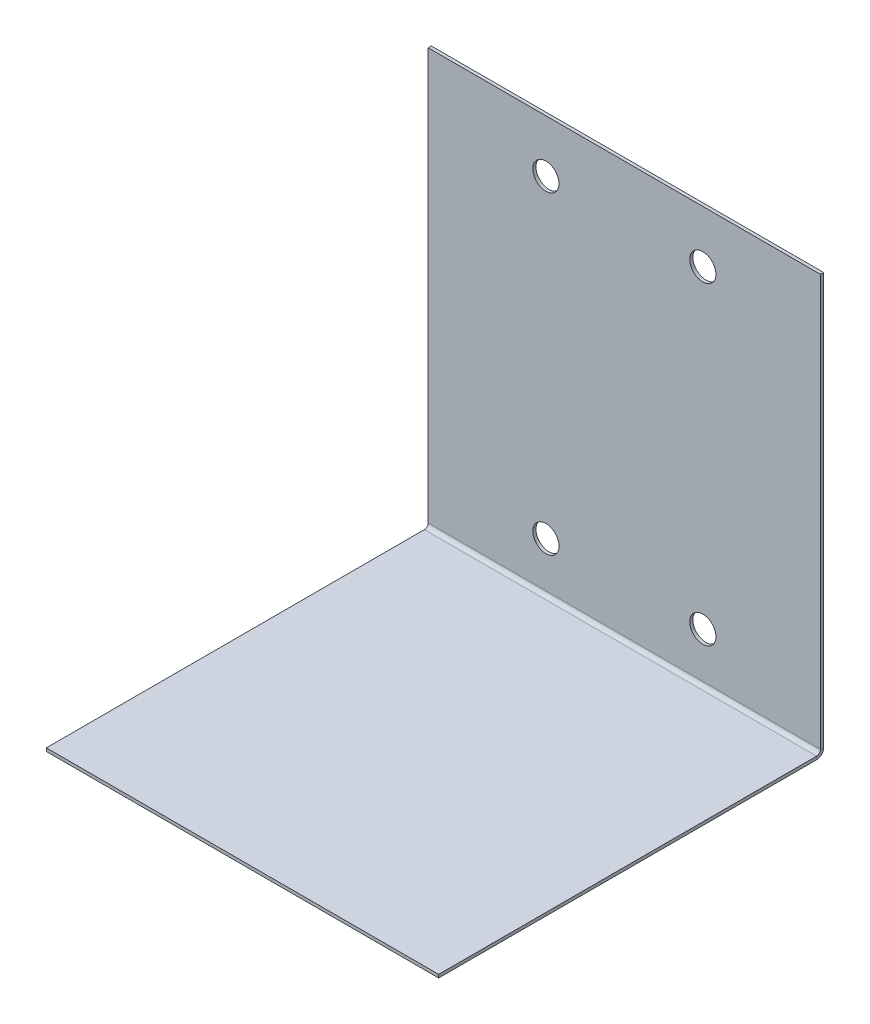
from build123d import *

# Parameters (mm, degrees)
SKETCH2_W                    = 75
SKETCH2_H                    = 80
BASE_FLANGE1_DEPTH           = 0.6
CUT_EXTRUDE1_REACH           = 111.66
SKETCH10_R                   = 2.5
EDGE_FLANGE1_STRIP_W         = 3.8732
EDGE_FLANGE1_STRIP_H         = 0.6
EDGE_FLANGE1_STRIP_CUT_DEPTH = 75
EDGE_FLANGE1_DEPTH           = 75


# Sheet-metal steps are written as plain solids
with BuildPart() as part:
    # Sketch2 → Base-Flange1 (new body)
    with BuildSketch(Plane.XY):
        with Locations((37.5, 40)):
            Rectangle(SKETCH2_W, SKETCH2_H)
    extrude(amount=-BASE_FLANGE1_DEPTH)

    # Sketch10 → Cut-Extrude1 (cut, up to next)
    with BuildSketch(Plane(origin=(0, 0, -0.6), x_dir=(-1, 0, 0), z_dir=(0, 0, -1)), mode=Mode.PRIVATE) as cut_extrude1_sk1:
        with Locations((-22.5, 10)):
            Circle(SKETCH10_R)
    cut_extrude1_tool1 = extrude(cut_extrude1_sk1.sketch, amount=-CUT_EXTRUDE1_REACH, mode=Mode.PRIVATE) & part.part
    # Sketch10 → Cut-Extrude1 (cut, up to next)
    with BuildSketch(Plane(origin=(0, 0, -0.6), x_dir=(-1, 0, 0), z_dir=(0, 0, -1)), mode=Mode.PRIVATE) as cut_extrude1_sk2:
        with Locations((-52.5, 70)):
            Circle(SKETCH10_R)
    cut_extrude1_tool2 = extrude(cut_extrude1_sk2.sketch, amount=-CUT_EXTRUDE1_REACH, mode=Mode.PRIVATE) & part.part
    # Sketch10 → Cut-Extrude1 (cut, up to next)
    with BuildSketch(Plane(origin=(0, 0, -0.6), x_dir=(-1, 0, 0), z_dir=(0, 0, -1)), mode=Mode.PRIVATE) as cut_extrude1_sk3:
        with Locations((-52.5, 10)):
            Circle(SKETCH10_R)
    cut_extrude1_tool3 = extrude(cut_extrude1_sk3.sketch, amount=-CUT_EXTRUDE1_REACH, mode=Mode.PRIVATE) & part.part
    # Sketch10 → Cut-Extrude1 (cut, up to next)
    with BuildSketch(Plane(origin=(0, 0, -0.6), x_dir=(-1, 0, 0), z_dir=(0, 0, -1)), mode=Mode.PRIVATE) as cut_extrude1_sk4:
        with Locations((-22.5, 70)):
            Circle(SKETCH10_R)
    cut_extrude1_tool4 = extrude(cut_extrude1_sk4.sketch, amount=-CUT_EXTRUDE1_REACH, mode=Mode.PRIVATE) & part.part
    add(cut_extrude1_tool1.solids().sort_by_distance((22.5, 10, -0.6))[0], mode=Mode.SUBTRACT)
    add(cut_extrude1_tool2.solids().sort_by_distance((52.5, 70, -0.6))[0], mode=Mode.SUBTRACT)
    add(cut_extrude1_tool3.solids().sort_by_distance((52.5, 10, -0.6))[0], mode=Mode.SUBTRACT)
    add(cut_extrude1_tool4.solids().sort_by_distance((22.5, 70, -0.6))[0], mode=Mode.SUBTRACT)

    # Edge-Flange1 strip (across the edge) → Edge-Flange1 strip cut (cut)
    with BuildSketch(Plane.YZ):
        with Locations((-0.6, -0.3)):
            Rectangle(EDGE_FLANGE1_STRIP_W, EDGE_FLANGE1_STRIP_H)
    extrude(amount=EDGE_FLANGE1_STRIP_CUT_DEPTH, mode=Mode.SUBTRACT)

    # Edge-Flange1 section (across the edge) → Edge-Flange1 (add)
    with BuildSketch(Plane.YZ):
        with BuildLine():
            Line((0, 0.7366), (0, 73))
            Line((0, 73), (0.6, 73))
            Line((0.6, 73), (0.6, 0.7366))
            ThreePointArc((0.6, 0.7366), (0.815745145, 0.215745145), (1.3366, 0))
            Line((1.3366, 0), (1.3366, -0.6))
            ThreePointArc((1.3366, -0.6), (0.391481076, -0.208518924), (0, 0.7366))
        make_face()
    extrude(amount=EDGE_FLANGE1_DEPTH)


solid = part.part
